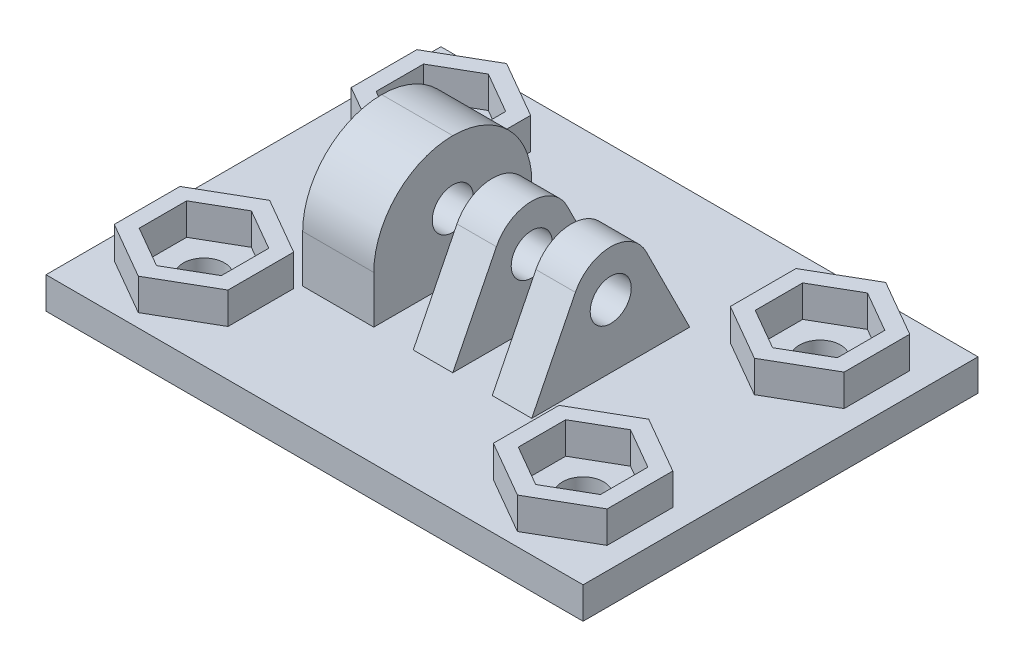
from build123d import *

# Parameters (mm, degrees)
SKETCH1_W           = 43.18
SKETCH1_H           = 31.75
SKETCH1_R           = 1.651
BOSS_EXTRUDE1_DEPTH = 2.54
SKETCH2_R           = 1.651
BOSS_EXTRUDE2_DEPTH = 7.9375
SKETCH3_W           = 3.175
SKETCH3_H           = 12.7
CUT_EXTRUDE1_DEPTH  = 12.7
FILLET1_R           = 3.175
SKETCH6_W           = 12.7
SKETCH6_H           = 10.16
SKETCH6_R           = 1.651
BOSS_EXTRUDE5_DEPTH = 3.175
SKETCH4_W           = 12.7
SKETCH4_H           = 10.16
BOSS_EXTRUDE6_DEPTH = 2.54
FILLET2_R           = 6.35
BOSS_EXTRUDE7_DEPTH = 2.54


with BuildPart() as part:
    # Sketch1 → Boss-Extrude1 (new body)
    with BuildSketch(Plane(origin=(0, 0, 0), x_dir=(1, 0, 0), z_dir=(0, 1, 0))):
        with Locations((0, 15.875)):
            Rectangle(SKETCH1_W, SKETCH1_H)
        with Locations(Location((-15.24, 25.4, 0), (0, 0, 270))):
            Circle(SKETCH1_R, mode=Mode.SUBTRACT)
        with Locations(Location((-15.24, 6.35, 0), (0, 0, 270))):
            Circle(SKETCH1_R, mode=Mode.SUBTRACT)
        with Locations(Location((15.24, 25.4, 0), (0, 0, 270))):
            Circle(SKETCH1_R, mode=Mode.SUBTRACT)
        with Locations(Location((15.24, 6.35, 0), (0, 0, 270))):
            Circle(SKETCH1_R, mode=Mode.SUBTRACT)
    extrude(amount=BOSS_EXTRUDE1_DEPTH)

    # Sketch2 → Boss-Extrude2 (add, symmetric)
    with BuildSketch(Plane(origin=(0, 0, 0), x_dir=(0, 0, -1), z_dir=(1, 0, 0))):
        Polygon((22.225, 2.54), (15.875, 15.24), (9.525, 2.54), align=None)
        with Locations((15.875, 7.62)):
            Circle(SKETCH2_R, mode=Mode.SUBTRACT)
    extrude(amount=BOSS_EXTRUDE2_DEPTH, both=True)

    # Sketch3 → Cut-Extrude1 (cut)
    with BuildSketch(Plane(origin=(0, 2.54, 0), x_dir=(1, 0, 0), z_dir=(0, 1, 0))):
        with Locations((-3.175, 15.875)):
            Rectangle(SKETCH3_W, SKETCH3_H)
        with Locations((3.175, 15.875)):
            Rectangle(SKETCH3_W, SKETCH3_H)
    extrude(amount=CUT_EXTRUDE1_DEPTH, mode=Mode.SUBTRACT)

    # Fillet1
    fillet1_edges = [part.edges().sort_by_distance(p)[0] for p in [
        (6.35, 15.24, -15.875),
        (-6.35, 15.24, -15.875),
        (0, 15.24, -15.875),
    ]]
    fillet(fillet1_edges, radius=FILLET1_R)

    # Sketch6 → Boss-Extrude5 (add)
    with BuildSketch(Plane.ZY.offset(7.9375)):
        with Locations((-15.875, 7.62)):
            Rectangle(SKETCH6_W, SKETCH6_H)
        with Locations((-15.875, 7.62)):
            Circle(SKETCH6_R, mode=Mode.SUBTRACT)
    extrude(amount=-BOSS_EXTRUDE5_DEPTH)

    # Sketch4 → Boss-Extrude6 (add)
    with BuildSketch(Plane.ZY.offset(7.9375)):
        with Locations((-15.875, 7.62)):
            Rectangle(SKETCH4_W, SKETCH4_H)
        Polygon((-19.177, 5.713589411), (-15.875, 3.807178822), (-12.573, 5.713589411), (-12.573, 9.526410589), (-15.875, 11.432821178), (-19.177, 9.526410589), align=None, mode=Mode.SUBTRACT)
    extrude(amount=BOSS_EXTRUDE6_DEPTH)

    # Fillet2
    fillet2_edges = [part.edges().sort_by_distance(p)[0] for p in [
        (-7.62, 12.7, -9.525),
        (-7.62, 12.7, -22.225),
    ]]
    fillet(fillet2_edges, radius=FILLET2_R - 0.0001)  # a hair under: the kernel refuses the full size

    # Sketch7 → Boss-Extrude7 (add)
    # profile 1 of 4: a face of its own
    with BuildSketch(Plane(origin=(0, 2.54, 0), x_dir=(1, 0, 0), z_dir=(0, 1, 0))):
        Polygon((-15.24, 30.679290861), (-19.812, 28.039645431), (-19.812, 22.760354569), (-15.24, 20.120709139), (-10.668, 22.760354569), (-10.668, 28.039645431), align=None)
        Polygon((-15.24, 29.212821178), (-18.542, 27.306410589), (-18.542, 23.493589411), (-15.24, 21.587178822), (-11.938, 23.493589411), (-11.938, 27.306410589), align=None, mode=Mode.SUBTRACT)
    # profile 2 of 4: a face of its own
    with BuildSketch(Plane(origin=(0, 2.54, 0), x_dir=(1, 0, 0), z_dir=(0, 1, 0))):
        Polygon((15.24, 30.679290861), (10.668, 28.039645431), (10.668, 22.760354569), (15.24, 20.120709139), (19.812, 22.760354569), (19.812, 28.039645431), align=None)
        Polygon((15.24, 29.212821178), (11.938, 27.306410589), (11.938, 23.493589411), (15.24, 21.587178822), (18.542, 23.493589411), (18.542, 27.306410589), align=None, mode=Mode.SUBTRACT)
    # profile 3 of 4: a face of its own
    with BuildSketch(Plane(origin=(0, 2.54, 0), x_dir=(1, 0, 0), z_dir=(0, 1, 0))):
        Polygon((15.24, 11.629290861), (10.668, 8.989645431), (10.668, 3.710354569), (15.24, 1.070709139), (19.812, 3.710354569), (19.812, 8.989645431), align=None)
        Polygon((15.24, 10.162821178), (11.938, 8.256410589), (11.938, 4.443589411), (15.24, 2.537178822), (18.542, 4.443589411), (18.542, 8.256410589), align=None, mode=Mode.SUBTRACT)
    # profile 4 of 4: a face of its own
    with BuildSketch(Plane(origin=(0, 2.54, 0), x_dir=(1, 0, 0), z_dir=(0, 1, 0))):
        Polygon((-15.24, 11.629290861), (-19.812, 8.989645431), (-19.812, 3.710354569), (-15.24, 1.070709139), (-10.668, 3.710354569), (-10.668, 8.989645431), align=None)
        Polygon((-15.24, 10.162821178), (-18.542, 8.256410589), (-18.542, 4.443589411), (-15.24, 2.537178822), (-11.938, 4.443589411), (-11.938, 8.256410589), align=None, mode=Mode.SUBTRACT)
    extrude(amount=BOSS_EXTRUDE7_DEPTH)


solid = part.part
